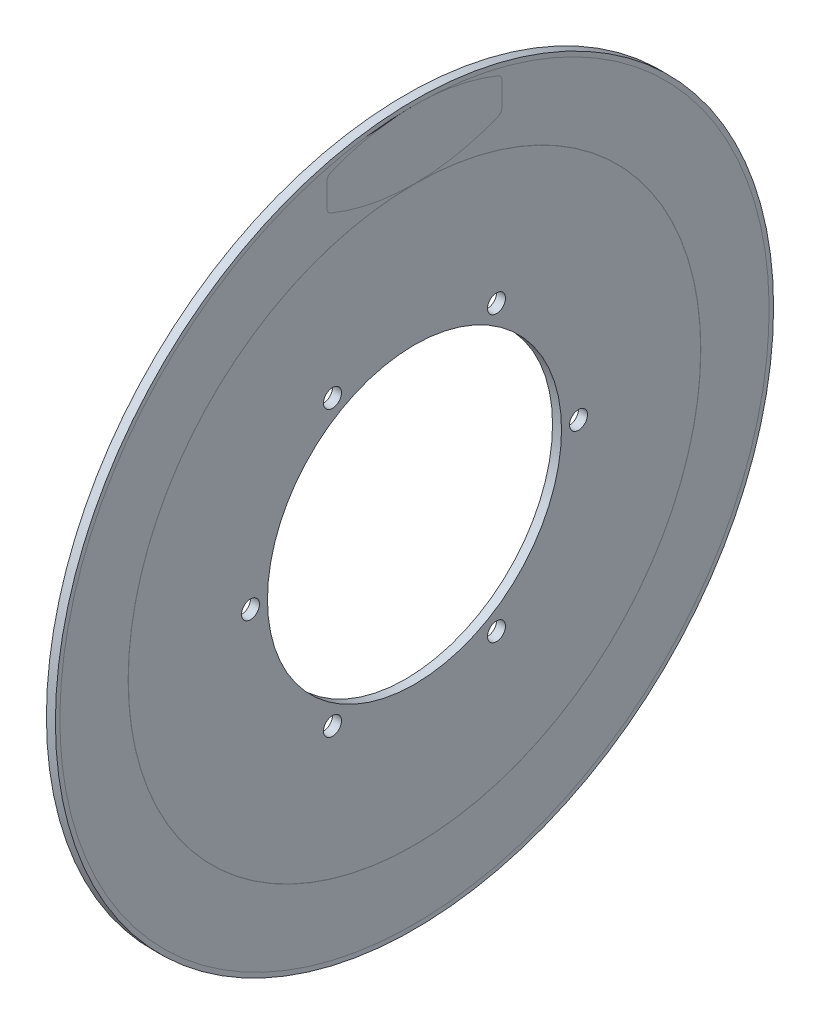
from build123d import *

# Parameters (mm, degrees)
SKETCH1_R           = 127
SKETCH1_R_2         = 3.175
SKETCH1_R_3         = 52
BOSS_EXTRUDE1_DEPTH = 3.175


with BuildPart() as part:
    # Sketch1 → Boss-Extrude1 (new body)
    with BuildSketch(Plane(origin=(0, 0, 0), x_dir=(0, 0, -1), z_dir=(1, 0, 0))):
        Circle(SKETCH1_R)
        with Locations((-29, -50.229473419)):
            Circle(SKETCH1_R_2, mode=Mode.SUBTRACT)
        with Locations((29, -50.229473419)):
            Circle(SKETCH1_R_2, mode=Mode.SUBTRACT)
        with Locations((-58, 0)):
            Circle(SKETCH1_R_2, mode=Mode.SUBTRACT)
        with Locations((-29, 50.229473419)):
            Circle(SKETCH1_R_2, mode=Mode.SUBTRACT)
        Circle(SKETCH1_R_3, mode=Mode.SUBTRACT)
        with Locations((58, 0)):
            Circle(SKETCH1_R_2, mode=Mode.SUBTRACT)
        with Locations((29, 50.229473419)):
            Circle(SKETCH1_R_2, mode=Mode.SUBTRACT)
    extrude(amount=BOSS_EXTRUDE1_DEPTH)


solid = part.part
